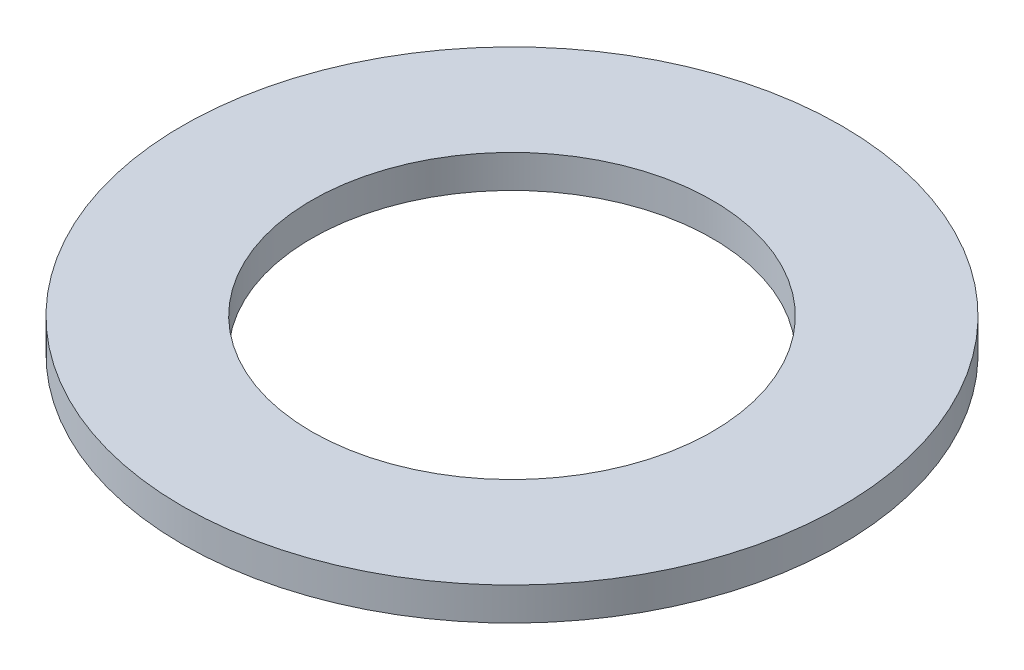
from build123d import *

# Parameters (mm, degrees)
SKETCH1_R           = 7.9375
SKETCH1_R_2         = 4.826
BOSS_EXTRUDE1_DEPTH = 0.79375


with BuildPart() as part:
    # Sketch1 → Boss-Extrude1 (new body)
    with BuildSketch(Plane(origin=(0, 0, 0), x_dir=(1, 0, 0), z_dir=(0, 1, 0))):
        Circle(SKETCH1_R)
        Circle(SKETCH1_R_2, mode=Mode.SUBTRACT)
    extrude(amount=BOSS_EXTRUDE1_DEPTH)


solid = part.part
